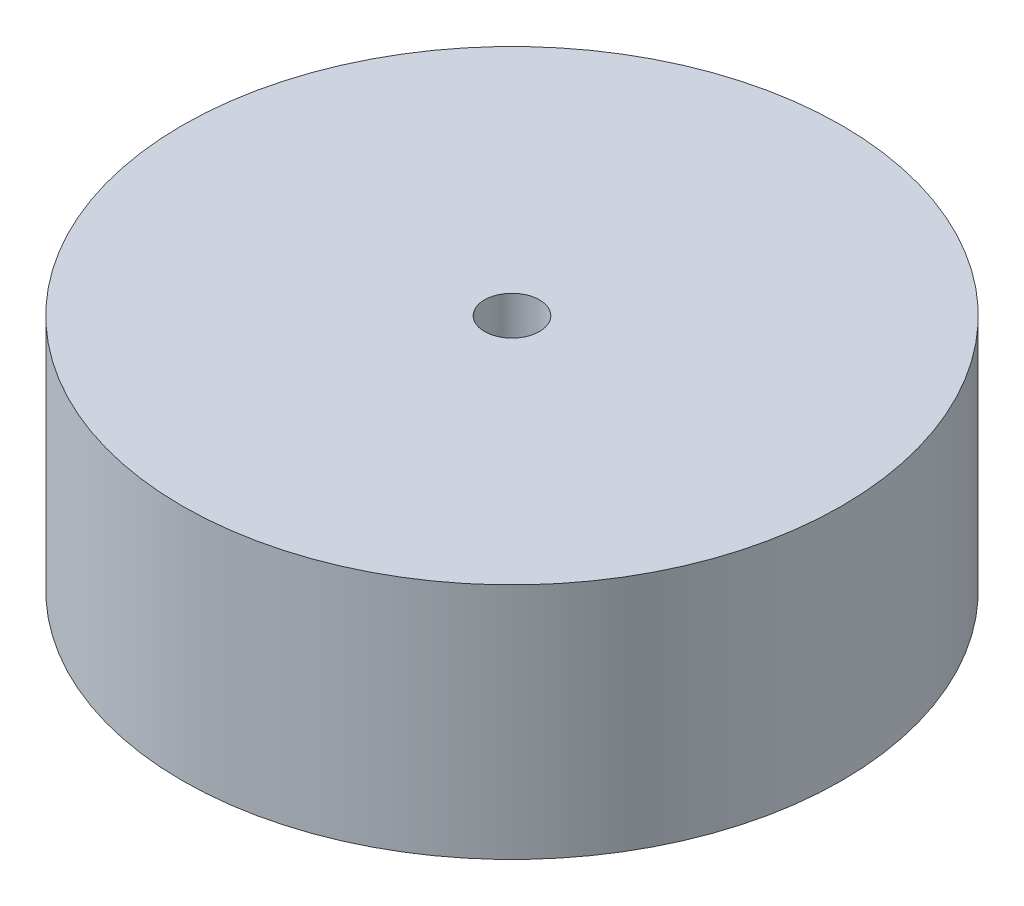
from build123d import *

# Parameters (mm, degrees)
SKETCH1_R           = 15
BOSS_EXTRUDE2_DEPTH = 10.82
SKETCH2_R           = 1.25
CUT_EXTRUDE1_DEPTH  = 7.65


with BuildPart() as part:
    # Sketch1 → Boss-Extrude2 (new body)
    with BuildSketch(Plane(origin=(0, 0, 0), x_dir=(1, 0, 0), z_dir=(0, 1, 0))):
        Circle(SKETCH1_R)
    extrude(amount=BOSS_EXTRUDE2_DEPTH)

    # Sketch2 → Cut-Extrude1 (cut)
    with BuildSketch(Plane(origin=(0, 10.82, 0), x_dir=(1, 0, 0), z_dir=(0, 1, 0))):
        Circle(SKETCH2_R)
    extrude(amount=-CUT_EXTRUDE1_DEPTH, mode=Mode.SUBTRACT)


solid = part.part
